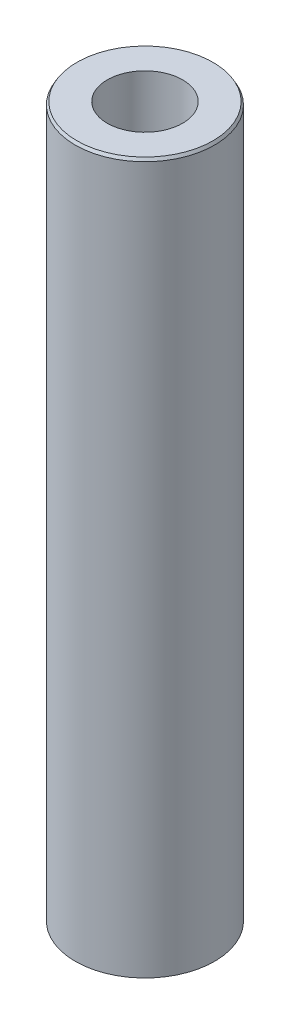
from build123d import *
from OCP.BRepFilletAPI import BRepFilletAPI_MakeChamfer

# Parameters (mm, degrees)
SKETCH1_R           = 42.5
BOSS_EXTRUDE1_DEPTH = 433.900877863
SKETCH2_R           = 22.974250683
CUT_EXTRUDE1_DEPTH  = 439.04391539
CHAMFER1_SIZE       = 1.757180541
CHAMFER1_SIZE2      = 1.014508658


with BuildPart() as part:
    # Sketch1 → Boss-Extrude1 (new body)
    with BuildSketch(Plane(origin=(0, 0, 0), x_dir=(1, 0, 0), z_dir=(0, 1, 0))):
        Circle(SKETCH1_R)
    extrude(amount=BOSS_EXTRUDE1_DEPTH)

    # Sketch2 → Cut-Extrude1 (cut, through all)
    with BuildSketch(Plane(origin=(0, 0, 0), x_dir=(1, 0, 0), z_dir=(0, 1, 0))):
        Circle(SKETCH2_R)
    extrude(amount=CUT_EXTRUDE1_DEPTH, mode=Mode.SUBTRACT)

    # Chamfer1: one chamfer whose edges measure the first distance from different faces: ONE call of the kernel's chamfer builder (chamfer() names one face for all edges)
    chamfer1_edges_1 = [part.edges().sort_by_distance(p)[0] for p in [
        (-42.5, 433.900877863, 0),
    ]]
    chamfer1_side_1 = [part.faces().sort_by_distance(p)[0] for p in [
        (-42.5, 216.950438932, 0),
    ]]
    chamfer1_edges_2 = [part.edges().sort_by_distance(p)[0] for p in [
        (-42.5, 0, 0),
    ]]
    chamfer1_side_2 = [part.faces().sort_by_distance(p)[0] for p in [
        (-41.297918472, 0, 0),
    ]]
    chamfer1 = BRepFilletAPI_MakeChamfer(part.part.solid().wrapped)
    for e in chamfer1_edges_1:
        chamfer1.Add(CHAMFER1_SIZE, CHAMFER1_SIZE2, e.wrapped, chamfer1_side_1[0].wrapped)  # the first distance lies on this face
    for e in chamfer1_edges_2:
        chamfer1.Add(CHAMFER1_SIZE, CHAMFER1_SIZE2, e.wrapped, chamfer1_side_2[0].wrapped)  # the first distance lies on this face
    add(Compound.cast(chamfer1.Shape()), mode=Mode.REPLACE)


solid = part.part
